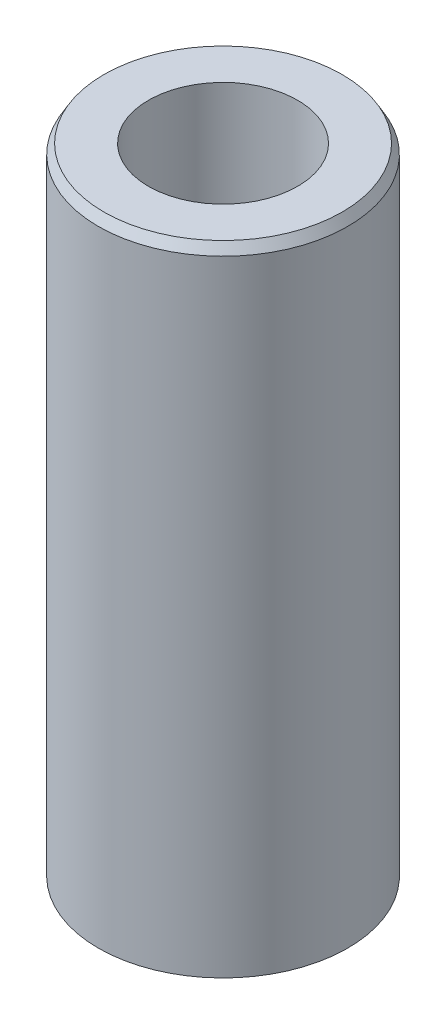
from build123d import *
from OCP.BRepFilletAPI import BRepFilletAPI_MakeChamfer

# Parameters (mm, degrees)
SKETCH1_R           = 7.5
BOSS_EXTRUDE1_DEPTH = 38.502881987
SKETCH2_R           = 4.486796821
CUT_EXTRUDE1_DEPTH  = 40.93709956
CHAMFER1_SIZE       = 0.580807415
CHAMFER1_SIZE2      = 0.335329317


with BuildPart() as part:
    # Sketch1 → Boss-Extrude1 (new body)
    with BuildSketch(Plane(origin=(0, 0, 0), x_dir=(1, 0, 0), z_dir=(0, 1, 0))):
        Circle(SKETCH1_R)
    extrude(amount=BOSS_EXTRUDE1_DEPTH)

    # Sketch2 → Cut-Extrude1 (cut, through all)
    with BuildSketch(Plane(origin=(0, 0, 0), x_dir=(1, 0, 0), z_dir=(0, 1, 0))):
        Circle(SKETCH2_R)
    extrude(amount=CUT_EXTRUDE1_DEPTH, mode=Mode.SUBTRACT)

    # Chamfer1: one chamfer whose edges measure the first distance from different faces: ONE call of the kernel's chamfer builder (chamfer() names one face for all edges)
    chamfer1_edges_1 = [part.edges().sort_by_distance(p)[0] for p in [
        (-7.5, 38.502881987, 0),
    ]]
    chamfer1_side_1 = [part.faces().sort_by_distance(p)[0] for p in [
        (-7.5, 19.251440993, 0),
    ]]
    chamfer1_edges_2 = [part.edges().sort_by_distance(p)[0] for p in [
        (-7.5, 0, 0),
    ]]
    chamfer1_side_2 = [part.faces().sort_by_distance(p)[0] for p in [
        (-7.287867966, 0, 0),
    ]]
    chamfer1 = BRepFilletAPI_MakeChamfer(part.part.solid().wrapped)
    for e in chamfer1_edges_1:
        chamfer1.Add(CHAMFER1_SIZE, CHAMFER1_SIZE2, e.wrapped, chamfer1_side_1[0].wrapped)  # the first distance lies on this face
    for e in chamfer1_edges_2:
        chamfer1.Add(CHAMFER1_SIZE, CHAMFER1_SIZE2, e.wrapped, chamfer1_side_2[0].wrapped)  # the first distance lies on this face
    add(Compound.cast(chamfer1.Shape()), mode=Mode.REPLACE)


solid = part.part
